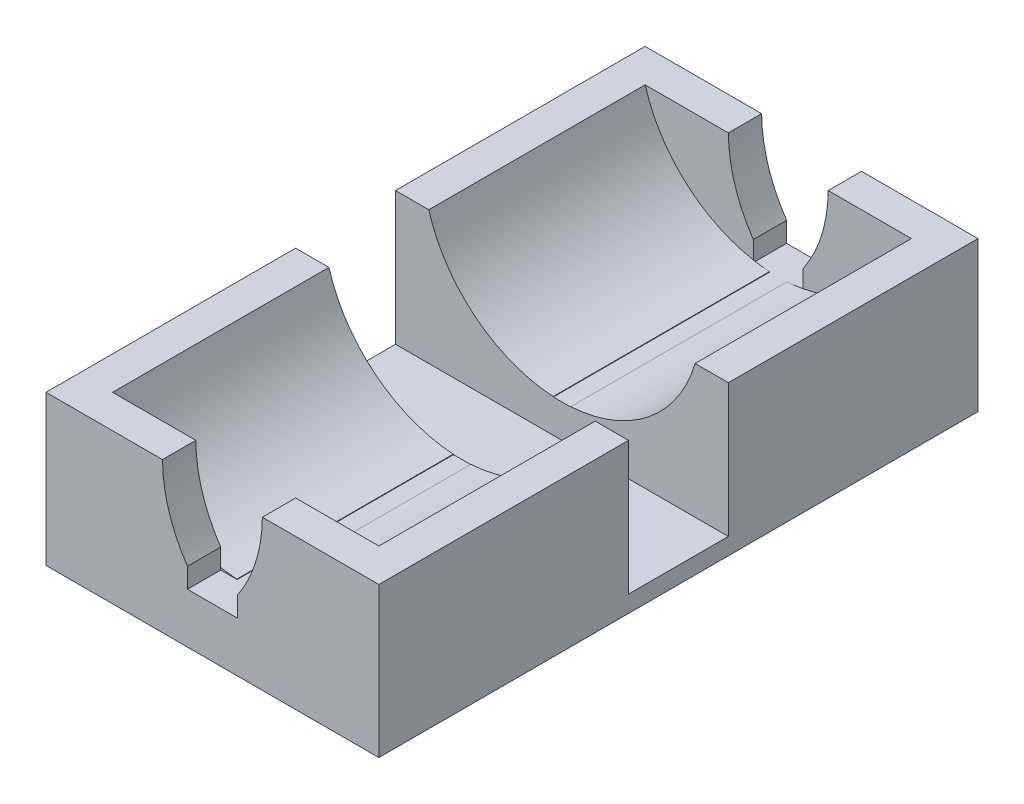
from build123d import *

# Parameters (mm, degrees)
BOSS_EXTRUDE1_DEPTH     = 15.045877519
BOSS_EXTRUDE2_DEPTH     = 30
BOSS_EXTRUDE3_DEPTH     = 160
CUT_EXTRUDE1_DEPTH      = 397.42670329
CUT_EXTRUDE1_DEPTH_BACK = 397.42670329
SKETCH5_W               = 30
SKETCH5_H               = 30
CUT_EXTRUDE2_START      = -30
CUT_EXTRUDE2_DEPTH      = 30
CUT_EXTRUDE3_DEPTH      = 10
CUT_EXTRUDE4_DEPTH      = 263.019333412


# Read off the part's stored shape, not the designer's step: Boss-Extrude3
with BuildPart() as part:
    # Sketch1 → Boss-Extrude1 (new body)
    with BuildSketch(Plane(origin=(0, 0, 0), x_dir=(1, 0, 0), z_dir=(0, 1, 0))):
        with BuildLine():
            Line((-185, -65), (5, -65))
            ThreePointArc((5, -65), (60.514401442, -84.704810384), (91.182336182, -135))
            Line((91.182336182, -135), (185, -135))
            Line((185, -135), (185, 135))
            Line((185, 135), (-185, 135))
            Line((-185, 135), (-185, -65))
        make_face()
    extrude(amount=BOSS_EXTRUDE1_DEPTH)

    # Sketch2 → Boss-Extrude2 (add)
    with BuildSketch(Plane(origin=(0, 15.045877519, 0), x_dir=(1, 0, 0), z_dir=(0, 1, 0))):
        Polygon((-175, -35), (-175, 30), (-185, 30), (-185, -45), (-142.5, -45), (-142.5, -35), align=None)
        Polygon((-175, 125), (-142.5, 125), (-142.5, 135), (-185, 135), (-185, 60), (-175, 60), align=None)
        Polygon((-95, -35), (-95, 30), (-85, 30), (-85, -45), (-127.5, -45), (-127.5, -35), align=None)
        Polygon((-127.5, 135), (-127.5, 125), (-95, 125), (-95, 60), (-85, 60), (-85, 135), align=None)
    extrude(amount=BOSS_EXTRUDE2_DEPTH)

    # Boss-Extrude3 outline → Boss-Extrude3 (add)
    with BuildSketch(Plane.XY.offset(-125)):
        with BuildLine():
            ThreePointArc((-95, 45.045877519), (-110, 23.379210852), (-135, 15.045877519))
            Line((-135, 15.045877519), (-95, 15.045877519))
            Line((-95, 15.045877519), (-95, 45.045877519))
        make_face()
        with BuildLine():
            Line((-175, 45.045877519), (-175, 15.045877519))
            Line((-175, 15.045877519), (-135, 15.045877519))
            ThreePointArc((-135, 15.045877519), (-160, 23.379210852), (-175, 45.045877519))
        make_face()
    extrude(amount=BOSS_EXTRUDE3_DEPTH)

    # Sketch5 → Cut-Extrude1 (cut, two sides: drawn at the far end of the back side and taken through both)
    with BuildSketch(Plane.ZY.offset(185).offset(-CUT_EXTRUDE1_DEPTH_BACK)):
        with Locations((-45, 30.045877519)):
            Rectangle(SKETCH5_W, SKETCH5_H)
    extrude(amount=CUT_EXTRUDE1_DEPTH + CUT_EXTRUDE1_DEPTH_BACK, mode=Mode.SUBTRACT)

    # Sketch6 → Cut-Extrude2 (cut)
    with BuildSketch(Plane(origin=(0, 15.045877519, 0), x_dir=(1, 0, 0), z_dir=(0, 1, 0)).offset(CUT_EXTRUDE2_START)):
        with BuildLine():
            Line((-142.5, -45), (-127.5, -45))
            Line((-127.5, -45), (-85, -45))
            Line((-85, -45), (-85, 30))
            Line((-85, 30), (-85, 60))
            Line((-85, 60), (-85, 135))
            Line((-85, 135), (185, 135))
            Line((185, 135), (185, -135))
            Line((185, -135), (91.182336182, -135))
            ThreePointArc((91.182336182, -135), (60.514401442, -84.704810384), (5, -65))
            Line((5, -65), (-185, -65))
            Line((-185, -65), (-185, -45))
            Line((-185, -45), (-142.5, -45))
        make_face()
    extrude(amount=CUT_EXTRUDE2_DEPTH, mode=Mode.SUBTRACT)

    # Sketch8 → Cut-Extrude3 (cut)
    with BuildSketch(Plane(origin=(0, 15.045877519, 0), x_dir=(1, 0, 0), z_dir=(0, 1, 0))):
        Polygon((-135, 30), (-85, 30), (-85, 60), (-135, 60), (-185, 60), (-185, 30), align=None)
    extrude(amount=-CUT_EXTRUDE3_DEPTH, mode=Mode.SUBTRACT)

    # Sketch9 → Cut-Extrude4 (cut, through all)
    with BuildSketch(Plane.XY.offset(45)):
        with BuildLine():
            Line((-150, 45.045877519), (-120, 45.045877519))
            ThreePointArc((-120, 45.045877519), (-123.28072965, 28.827812568), (-132.437534993, 15.045877519))
            Line((-132.437534993, 15.045877519), (-137.562465007, 15.045877519))
            ThreePointArc((-137.562465007, 15.045877519), (-146.71927035, 28.827812568), (-150, 45.045877519))
        make_face()
    extrude(amount=-CUT_EXTRUDE4_DEPTH, mode=Mode.SUBTRACT)


solid = part.part
